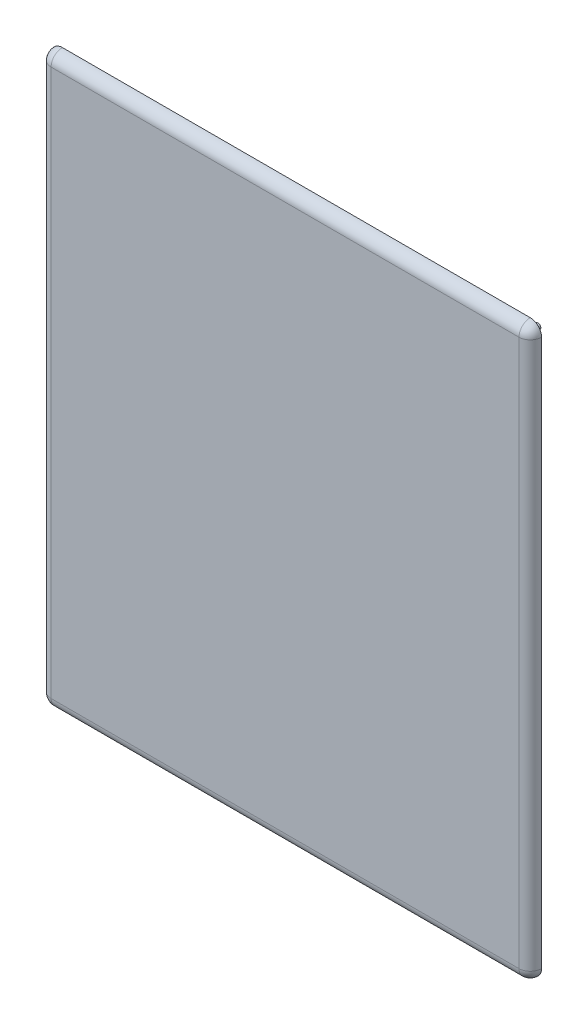
from build123d import *

# Parameters (mm, degrees)
SKETCH1_W           = 220.98
SKETCH1_H           = 256.54
BOSS_EXTRUDE1_DEPTH = 5.08
FILLET1_R           = 5.08
FILLET2_R           = 5.08
SKETCH2_R           = 1.27
BOSS_EXTRUDE2_DEPTH = 6.35


# Some blends are built 0.0001 mm under size
with BuildPart() as part:
    # Sketch1 → Boss-Extrude1 (new body)
    with BuildSketch(Plane.XY):
        with Locations((110.49, 128.27)):
            Rectangle(SKETCH1_W, SKETCH1_H)
    extrude(amount=BOSS_EXTRUDE1_DEPTH)

    # Fillet1
    fillet1_edges = [part.edges().sort_by_distance(p)[0] for p in [
        (110.49, 0, 5.08),
        (220.98, 128.27, 5.08),
        (0, 128.27, 5.08),
        (110.49, 256.54, 5.08),
    ]]
    fillet(fillet1_edges, radius=FILLET1_R - 0.0001)  # a hair under: the kernel refuses the full size

    # Fillet2
    # the kernel refuses this fillet: 5.08 mm, written as the material it takes off along each edge
    with BuildSketch(Plane(origin=(5.08, 251.46, 5.08), x_dir=(0, 1, 0), z_dir=(1, 0, 0))) as fillet2_piece_1:
        with BuildLine():
            CenterArc((0.0001, -5.0799), 5.0799, 0, 90)
            Line((5.08, -5.0799), (5.08, 0))
            Line((5.08, 0), (0.0001, 0))
        make_face()
    revolve(axis=Axis((5.08, 251.46, 5.08), (0, 0, 1)), revolution_arc=90, mode=Mode.SUBTRACT)
    with BuildSketch(Plane(origin=(215.9, 251.46, 5.08), x_dir=(1, 0, 0), z_dir=(0, -1, 0))) as fillet2_piece_2:
        with BuildLine():
            CenterArc((0.0001, -5.0799), 5.0799, 0, 90)
            Line((5.08, -5.0799), (5.08, 0))
            Line((5.08, 0), (0.0001, 0))
        make_face()
    revolve(axis=Axis((215.9, 251.46, 5.08), (0, 0, 1)), revolution_arc=90, mode=Mode.SUBTRACT)
    with BuildSketch(Plane(origin=(5.08, 5.08, 5.08), x_dir=(-1, 0, 0), z_dir=(0, 1, 0))) as fillet2_piece_3:
        with BuildLine():
            CenterArc((0.0001, -5.0799), 5.0799, 0, 90)
            Line((5.08, -5.0799), (5.08, 0))
            Line((5.08, 0), (0.0001, 0))
        make_face()
    revolve(axis=Axis((5.08, 5.08, 5.08), (0, 0, 1)), revolution_arc=90, mode=Mode.SUBTRACT)
    with BuildSketch(Plane(origin=(215.9, 5.08, 5.08), x_dir=(0, -1, 0), z_dir=(-1, 0, 0))) as fillet2_piece_4:
        with BuildLine():
            CenterArc((0.0001, -5.0799), 5.0799, 0, 90)
            Line((5.08, -5.0799), (5.08, 0))
            Line((5.08, 0), (0.0001, 0))
        make_face()
    revolve(axis=Axis((215.9, 5.08, 5.08), (0, 0, 1)), revolution_arc=90, mode=Mode.SUBTRACT)
    with BuildSketch(Plane(origin=(220.98, 0, -12.7), x_dir=(-1, 0, 0), z_dir=(0, 0, 1)), Plane(origin=(220.98, 256.54, -12.7), x_dir=(0, -1, 0), z_dir=(0, 0, 1))) as fillet2_piece_5:
        with BuildLine():
            CenterArc((FILLET2_R, -FILLET2_R), FILLET2_R, 90, 90)
            Line((0, -FILLET2_R), (0, 0))
            Line((0, 0), (FILLET2_R, 0))
        make_face()
    extrude(amount=17.78, mode=Mode.SUBTRACT)
    with BuildSketch(Plane(origin=(0, 0, -12.7), x_dir=(1, 0, 0), z_dir=(0, 0, 1)), Plane(origin=(0, 256.54, -12.7), x_dir=(0, -1, 0), z_dir=(0, 0, 1))) as fillet2_piece_6:
        with BuildLine():
            CenterArc((FILLET2_R, FILLET2_R), FILLET2_R, 180, 90)
            Line((0, FILLET2_R), (0, 0))
            Line((0, 0), (FILLET2_R, 0))
        make_face()
    extrude(amount=17.78, mode=Mode.SUBTRACT)

    # Sketch2 → Boss-Extrude2 (add)
    with BuildSketch(Plane(origin=(0, 0, 0), x_dir=(-1, 0, 0), z_dir=(0, 0, -1))):
        with Locations((-213.0425, 248.6025)):
            Circle(SKETCH2_R)
        with Locations((-7.9375, 248.6025)):
            Circle(SKETCH2_R)
        with Locations((-213.0425, 7.9375)):
            Circle(SKETCH2_R)
        with Locations((-7.9375, 7.9375)):
            Circle(SKETCH2_R)
    extrude(amount=BOSS_EXTRUDE2_DEPTH)


solid = part.part
